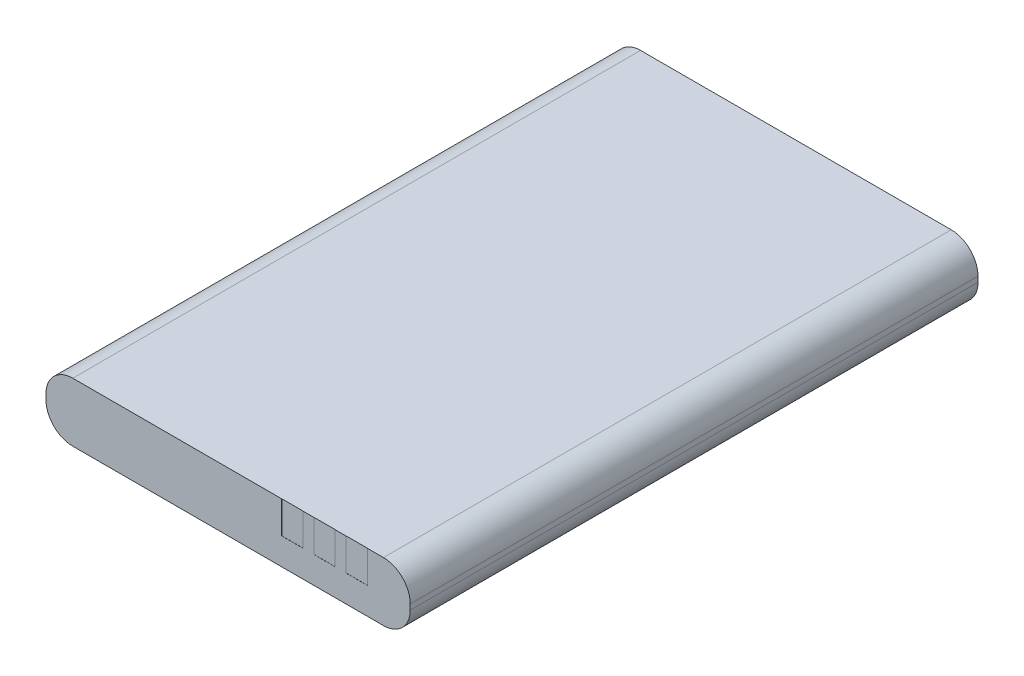
from build123d import *

# Parameters (mm, degrees)
SKETCH1_W           = 34
SKETCH1_H           = 53
BOSS_EXTRUDE1_DEPTH = 5.5
FILLET1_R           = 2.5
SKETCH2_W           = 2
SKETCH2_H           = 3
CUT_EXTRUDE1_DEPTH  = 0.01
LPATTERN1_COUNT     = 3
LPATTERN1_PITCH     = 3


with BuildPart() as part:
    # Sketch1 → Boss-Extrude1 (new body)
    with BuildSketch(Plane(origin=(0, 0, 0), x_dir=(1, 0, 0), z_dir=(0, 1, 0))):
        Rectangle(SKETCH1_W, SKETCH1_H)
    extrude(amount=BOSS_EXTRUDE1_DEPTH)

    # Fillet1
    fillet1_edges = [part.edges().sort_by_distance(p)[0] for p in [
        (-17, 0, 0),
        (-17, 5.5, 0),
        (17, 0, 0),
        (17, 5.5, 0),
    ]]
    fillet(fillet1_edges, radius=FILLET1_R)

    # Sketch2 → Cut-Extrude1 (cut)
    with BuildSketch(Plane.XY.offset(26.5)):
        with Locations((6, 4)):
            Rectangle(SKETCH2_W, SKETCH2_H)
    cut_extrude1 = extrude(amount=-CUT_EXTRUDE1_DEPTH, mode=Mode.SUBTRACT)

    # LPattern1: Cut-Extrude1 ×3
    with Locations(*[(i * LPATTERN1_PITCH, 0, 0) for i in range(1, LPATTERN1_COUNT)]):
        add(cut_extrude1, mode=Mode.SUBTRACT)


solid = part.part
